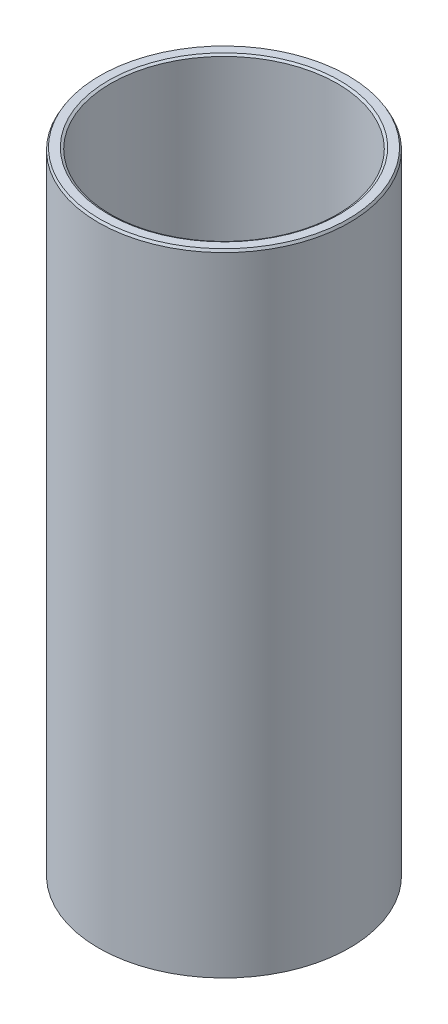
from build123d import *
from OCP.BRepFilletAPI import BRepFilletAPI_MakeChamfer

# Parameters (mm, degrees)
SKETCH1_R           = 55
BOSS_EXTRUDE1_DEPTH = 276.860027288
SKETCH2_R           = 49.664771316
CUT_EXTRUDE1_DEPTH  = 288.578640914
CHAMFER1_SIZE       = 1.051062442
CHAMFER1_SIZE2      = 0.606831184


with BuildPart() as part:
    # Sketch1 → Boss-Extrude1 (new body)
    with BuildSketch(Plane(origin=(0, 0, 0), x_dir=(1, 0, 0), z_dir=(0, 1, 0))):
        Circle(SKETCH1_R)
    extrude(amount=BOSS_EXTRUDE1_DEPTH)

    # Sketch2 → Cut-Extrude1 (cut, through all)
    with BuildSketch(Plane(origin=(0, 0, 0), x_dir=(1, 0, 0), z_dir=(0, 1, 0))):
        Circle(SKETCH2_R)
    extrude(amount=CUT_EXTRUDE1_DEPTH, mode=Mode.SUBTRACT)

    # Chamfer1: one chamfer whose edges measure the first distance from different faces: ONE call of the kernel's chamfer builder (chamfer() names one face for all edges)
    chamfer1_edges_1 = [part.edges().sort_by_distance(p)[0] for p in [
        (-49.664771316, 276.860027288, 0),
    ]]
    chamfer1_side_1 = [part.faces().sort_by_distance(p)[0] for p in [
        (-53.444365081, 276.860027288, 0),
    ]]
    chamfer1_edges_2 = [part.edges().sort_by_distance(p)[0] for p in [
        (-49.664771316, 0, 0),
    ]]
    chamfer1_side_2 = [part.faces().sort_by_distance(p)[0] for p in [
        (-49.664771316, 138.430013644, 0),
    ]]
    chamfer1_edges_3 = [part.edges().sort_by_distance(p)[0] for p in [
        (-55, 0, 0),
    ]]
    chamfer1_side_3 = [part.faces().sort_by_distance(p)[0] for p in [
        (-53.444365081, 0, 0),
    ]]
    chamfer1_edges_4 = [part.edges().sort_by_distance(p)[0] for p in [
        (-55, 276.860027288, 0),
    ]]
    chamfer1_side_4 = [part.faces().sort_by_distance(p)[0] for p in [
        (-55, 138.430013644, 0),
    ]]
    chamfer1 = BRepFilletAPI_MakeChamfer(part.part.solid().wrapped)
    for e in chamfer1_edges_1:
        chamfer1.Add(CHAMFER1_SIZE, CHAMFER1_SIZE2, e.wrapped, chamfer1_side_1[0].wrapped)  # the first distance lies on this face
    for e in chamfer1_edges_2:
        chamfer1.Add(CHAMFER1_SIZE, CHAMFER1_SIZE2, e.wrapped, chamfer1_side_2[0].wrapped)  # the first distance lies on this face
    for e in chamfer1_edges_3:
        chamfer1.Add(CHAMFER1_SIZE, CHAMFER1_SIZE2, e.wrapped, chamfer1_side_3[0].wrapped)  # the first distance lies on this face
    for e in chamfer1_edges_4:
        chamfer1.Add(CHAMFER1_SIZE, CHAMFER1_SIZE2, e.wrapped, chamfer1_side_4[0].wrapped)  # the first distance lies on this face
    add(Compound.cast(chamfer1.Shape()), mode=Mode.REPLACE)


solid = part.part
